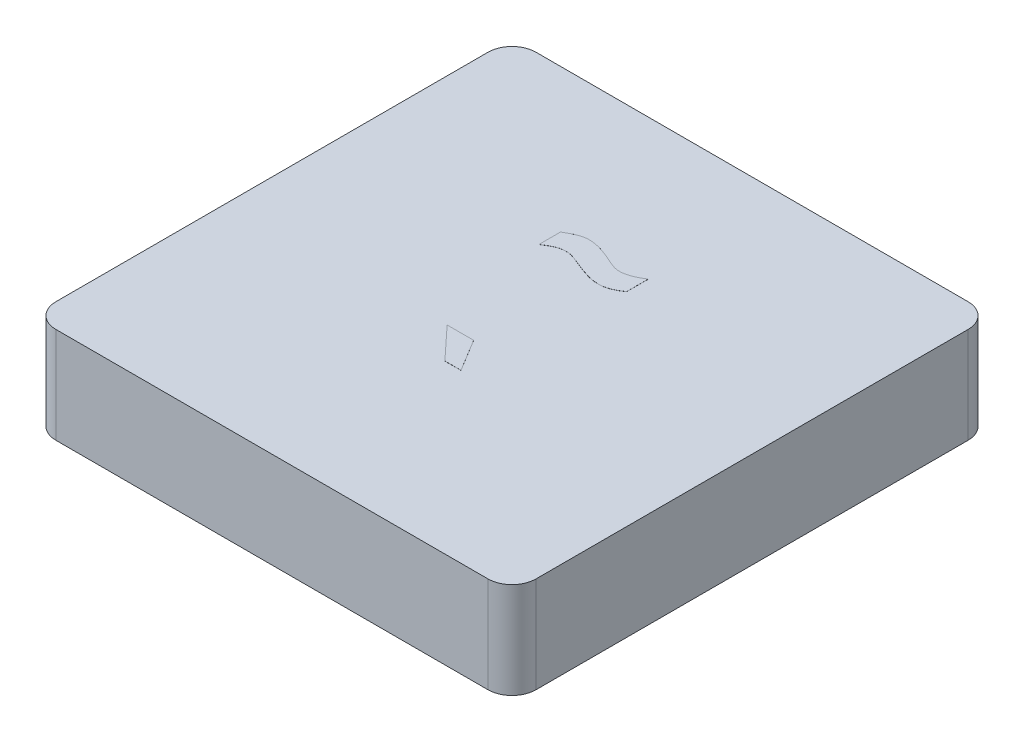
from build123d import *

# Parameters (mm, degrees)
SKETCH1_W           = 12.7
SKETCH1_H           = 12.7
BOSS_EXTRUDE1_DEPTH = 2.54
FILLET1_R           = 0.635
SHELL1_START        = 0.635
SHELL1_OUTLINE_W    = 1.905
SHELL1_OUTLINE_H    = 11.43
SHELL1_DEPTH        = 11.43
SKETCH2_R           = 2.54
BOSS_EXTRUDE2_DEPTH = 1.905
BOSS_EXTRUDE3_DEPTH = 0.00254


# Read off the part's stored shape, not the designer's step: Shell1
with BuildPart() as part:
    # Sketch1 → Boss-Extrude1 (new body)
    with BuildSketch(Plane(origin=(0, 0, 0), x_dir=(1, 0, 0), z_dir=(0, 1, 0))):
        with Locations((6.35, 6.35)):
            Rectangle(SKETCH1_W, SKETCH1_H)
    extrude(amount=BOSS_EXTRUDE1_DEPTH)

    # Fillet1
    fillet1_edges = [part.edges().sort_by_distance(p)[0] for p in [
        (0, 1.27, -12.7),
        (12.7, 1.27, -12.7),
        (12.7, 1.27, 0),
        (0, 1.27, 0),
    ]]
    fillet(fillet1_edges, radius=FILLET1_R)

    # Shell1 outline → Shell1 (cut)
    with BuildSketch(Plane.YZ.offset(SHELL1_START)):
        with Locations((0.9525, -6.35)):
            Rectangle(SHELL1_OUTLINE_W, SHELL1_OUTLINE_H)
    extrude(amount=SHELL1_DEPTH, mode=Mode.SUBTRACT)

    # Sketch2 → Boss-Extrude2 (add)
    with BuildSketch(Plane(origin=(0, 1.905, 0), x_dir=(-1, 0, 0), z_dir=(0, -1, 0))):
        with Locations(Location((-6.35, 6.35, 0), (0, 0, 270))):
            Circle(SKETCH2_R)
    extrude(amount=BOSS_EXTRUDE2_DEPTH)

    # Sketch3 → Boss-Extrude3 (add)
    with BuildSketch(Plane(origin=(0, 2.54, 0), x_dir=(1, 0, 0), z_dir=(0, 1, 0))):
        Polygon((6.411642829, 5.27375641), (6.931269231, 4.418948718), (6.50513742, 4.418948718), (5.710115385, 5.27375641), align=None)
        with BuildLine():
            Line((5.080325641, 8.333153846), (5.080325641, 8.903025641))
            add(Edge.make_bspline(
                [(5.080325641, 8.903025641), (5.107116622, 8.919158467), (5.158856938, 8.950315128), (5.235918867, 8.991651266), (5.309205163, 9.027027273), (5.379088546, 9.055681099), (5.445318097, 9.07824066), (5.507802803, 9.094263611), (5.566750704, 9.104549048), (5.605002578, 9.105899018), (5.623484696, 9.106551282)],
                knots=[0, 0, 0, 0, 1.279207482, 2.470480605, 3.576080812, 4.606860037, 5.558565817, 6.435744397, 7.244200283, 8, 8, 8, 8], degree=3))
            add(Edge.make_bspline(
                [(5.623484696, 9.106551282), (5.647252633, 9.10608216), (5.696197248, 9.10511611), (5.770940929, 9.096225937), (5.849121635, 9.082896049), (5.932404463, 9.063232193), (6.024309741, 9.035772523), (6.128219217, 8.999075098), (6.245748934, 8.952611932), (6.327892985, 8.91646479), (6.371441426, 8.897301482)],
                knots=[0, 0, 0, 0, 0.728864224, 1.500928647, 2.306032779, 3.161048191, 4.124103712, 5.247132966, 6.540575143, 8, 8, 8, 8], degree=3))
            add(Edge.make_bspline(
                [(6.371441426, 8.897301482), (6.398937756, 8.884854189), (6.448424397, 8.862452119), (6.515501601, 8.834429807), (6.566641046, 8.814091133), (6.596124718, 8.804955011), (6.608039984, 8.801262821)],
                knots=[0, 0, 0, 0, 1.417318505, 2.550825291, 3.414343566, 4, 4, 4, 4], degree=3))
            add(Edge.make_bspline(
                [(6.608039984, 8.801262821), (6.633154743, 8.795327171), (6.682531311, 8.783657459), (6.733229124, 8.781815384), (6.758140144, 8.780910256)],
                knots=[0, 0, 0, 0, 1.01727437, 2, 2, 2, 2], degree=3))
            add(Edge.make_bspline(
                [(6.758140144, 8.780910256), (6.778737764, 8.781558102), (6.820988878, 8.782887003), (6.885281854, 8.792925647), (6.951980152, 8.809139744), (7.021102843, 8.831372247), (7.092577195, 8.860369751), (7.166290369, 8.895358707), (7.242337948, 8.937076476), (7.292957038, 8.968303502), (7.319107692, 8.984435897)],
                knots=[0, 0, 0, 0, 0.817691354, 1.677299118, 2.577777856, 3.541554841, 4.557701377, 5.638471298, 6.779995431, 8, 8, 8, 8], degree=3))
            Line((7.319107692, 8.984435897), (7.319107692, 8.414564103))
            add(Edge.make_bspline(
                [(7.319107692, 8.414564103), (7.296635434, 8.398350673), (7.252631937, 8.366602748), (7.184346346, 8.325219904), (7.116456359, 8.290374664), (7.049081778, 8.261073651), (6.981942418, 8.239048359), (6.915204166, 8.222851078), (6.848756076, 8.21290154), (6.804390317, 8.211657593), (6.782308814, 8.211038462)],
                knots=[0, 0, 0, 0, 1.138472114, 2.229270987, 3.277482784, 4.272796559, 5.24538971, 6.177327133, 7.09282843, 8, 8, 8, 8], degree=3))
            add(Edge.make_bspline(
                [(6.782308814, 8.211038462), (6.734070736, 8.212764993), (6.636621448, 8.216252887), (6.527110127, 8.237556451), (6.451666575, 8.258503219), (6.406550833, 8.271812301), (6.356134507, 8.289361286), (6.29953379, 8.308711319), (6.237551107, 8.332007692), (6.169954271, 8.357956857), (6.096218469, 8.386587733), (6.04555015, 8.407472659), (6.01908766, 8.418380208)],
                knots=[0, 0, 0, 0, 1.816478987, 3.669602728, 4.183070076, 4.766772394, 5.441136484, 6.19386005, 7.020227999, 7.935420581, 8.921734247, 10, 10, 10, 10], degree=3))
            add(Edge.make_bspline(
                [(6.01908766, 8.418380208), (6.002332613, 8.424935618), (5.970509168, 8.437386536), (5.925038155, 8.455476927), (5.883685286, 8.471352947), (5.846629194, 8.48526161), (5.813753702, 8.496906564), (5.785288756, 8.506272562), (5.761265135, 8.514230216), (5.723286502, 8.52375686), (5.669365237, 8.534055878), (5.621424075, 8.535803844), (5.597407973, 8.536679487)],
                knots=[0, 0, 0, 0, 1.224273616, 2.325305503, 3.329974039, 4.238366513, 5.01858254, 5.702877263, 6.277757238, 6.739620974, 8.366714654, 10, 10, 10, 10], degree=3))
            add(Edge.make_bspline(
                [(5.597407973, 8.536679487), (5.579145964, 8.536202288), (5.542464937, 8.535243786), (5.487640677, 8.527022953), (5.432392514, 8.515183006), (5.375489546, 8.496720769), (5.313776653, 8.469947593), (5.24415197, 8.43419635), (5.164904001, 8.387896903), (5.109853792, 8.352265842), (5.080325641, 8.333153846)],
                knots=[0, 0, 0, 0, 0.776252433, 1.559178841, 2.353291584, 3.177347174, 4.098437677, 5.211375113, 6.504221197, 8, 8, 8, 8], degree=3))
        make_face()
    extrude(amount=BOSS_EXTRUDE3_DEPTH)


solid = part.part
